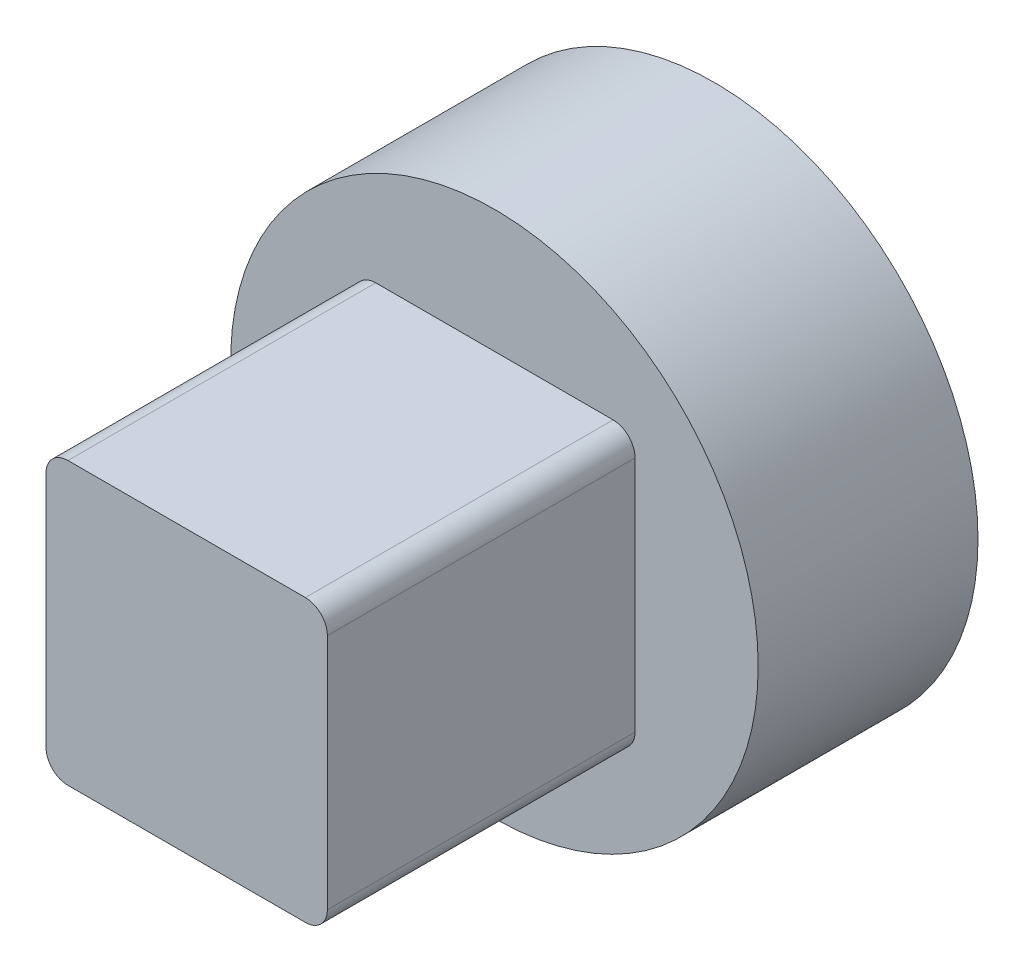
from build123d import *

# Parameters (mm, degrees)
SKETCH1_R           = 6
SKETCH1_R_2         = 2.5
BOSS_EXTRUDE1_DEPTH = 5
BOSS_EXTRUDE2_DEPTH = 7


with BuildPart() as part:
    # Sketch1 → Boss-Extrude1 (new body)
    with BuildSketch(Plane.XY.offset(-23.465471353)):
        with Locations((3.740457308, -31.828386779)):
            Circle(SKETCH1_R)
        with Locations((3.740457308, -31.828386779)):
            Circle(SKETCH1_R_2, mode=Mode.SUBTRACT)
    extrude(amount=BOSS_EXTRUDE1_DEPTH)

    # Sketch2 → Boss-Extrude2 (add)
    with BuildSketch(Plane.XY.offset(-18.465471353)):
        with BuildLine():
            Line((6.440457308, -28.628386779), (1.040457308, -28.628386779))
            ThreePointArc((1.040457308, -28.628386779), (0.686903918, -28.774833388), (0.540457308, -29.128386779))
            Line((0.540457308, -29.128386779), (0.540457308, -34.528386779))
            ThreePointArc((0.540457308, -34.528386779), (0.686903918, -34.881940169), (1.040457308, -35.028386779))
            Line((1.040457308, -35.028386779), (6.440457308, -35.028386779))
            ThreePointArc((6.440457308, -35.028386779), (6.794010699, -34.881940169), (6.940457308, -34.528386779))
            Line((6.940457308, -34.528386779), (6.940457308, -29.128386779))
            ThreePointArc((6.940457308, -29.128386779), (6.794010699, -28.774833388), (6.440457308, -28.628386779))
        make_face()
    extrude(amount=BOSS_EXTRUDE2_DEPTH)


solid = part.part
